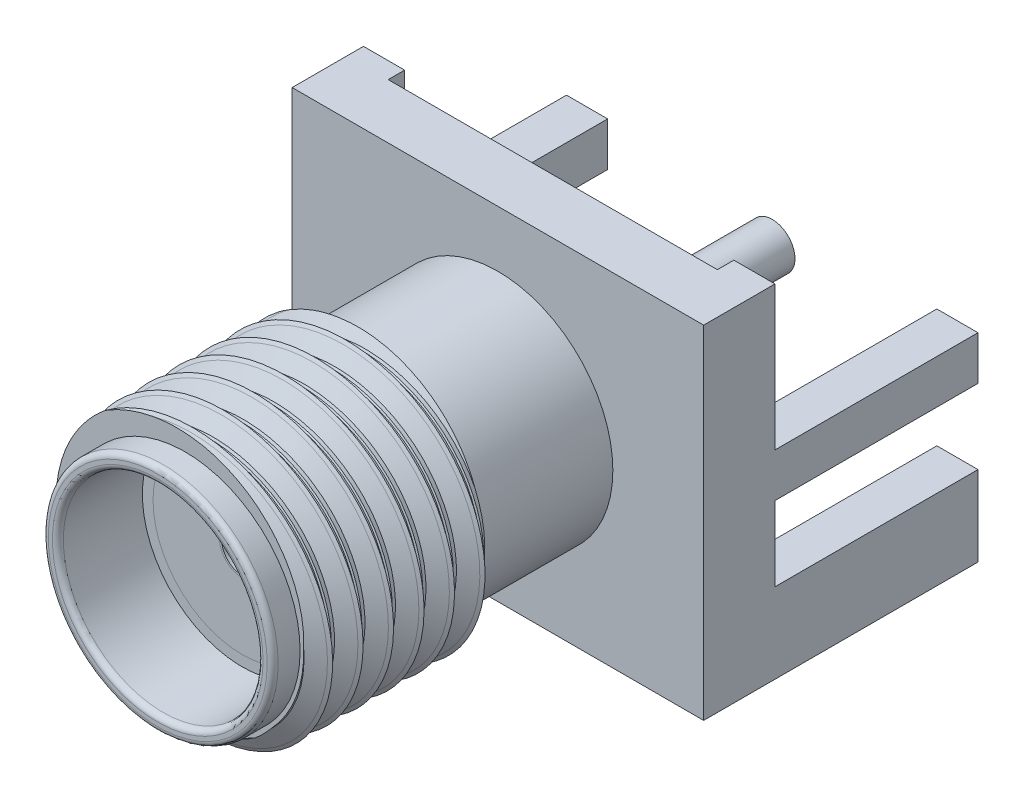
from build123d import *

# Parameters (mm, degrees)
SKETCH1_R           = 2.66065
BOSS_EXTRUDE1_DEPTH = 7.874
SKETCH2_R           = 2.3114
CUT_EXTRUDE1_DEPTH  = 1.9558
SKETCH5_W           = 9.525
SKETCH5_H           = 7.9248
SKETCH5_R           = 2.032
BOSS_EXTRUDE2_DEPTH = 1.651
SKETCH6_W           = 7.62
SKETCH6_H           = 0.381
CUT_EXTRUDE2_DEPTH  = 13.144288258
SKETCH7_R           = 0.47625
CUT_EXTRUDE3_DEPTH  = 10.781350042
SKETCH9_R           = 0.525859375
BOSS_EXTRUDE4_DEPTH = 6.35
SKETCH10_W          = 0.9525
SKETCH10_H          = 1.016
SKETCH10_H_2        = 1.8542
BOSS_EXTRUDE5_DEPTH = 4.699
BOSS_EXTRUDE6_START = -4.826
SKETCH13_R          = 3.16357
SKETCH13_R_2        = 2.66065
BOSS_EXTRUDE6_DEPTH = 4.191
CUT_SWEEP5_PITCH    = 0.705555556
FILLET1_R           = 0.127


with BuildPart() as part:
    # Sketch1 → Boss-Extrude1 (new body)
    with BuildSketch(Plane.XY):
        Circle(SKETCH1_R)
    extrude(amount=BOSS_EXTRUDE1_DEPTH)

    # Sketch2 → Cut-Extrude1 (cut)
    with BuildSketch(Plane.XY.offset(7.874)):
        Circle(SKETCH2_R)
    extrude(amount=-CUT_EXTRUDE1_DEPTH, mode=Mode.SUBTRACT)

    # Sketch7 → Cut-Extrude3 (cut, through all)
    with BuildSketch(Plane.XY.offset(5.9182)):
        Circle(SKETCH7_R)
    extrude(amount=-CUT_EXTRUDE3_DEPTH, mode=Mode.SUBTRACT)

    # Sketch13 → Boss-Extrude6 (add)
    with BuildSketch(Plane.XY.offset(7.874).offset(BOSS_EXTRUDE6_START)):
        Circle(SKETCH13_R)
        Circle(SKETCH13_R_2, mode=Mode.SUBTRACT)
    extrude(amount=BOSS_EXTRUDE6_DEPTH)

    # Cut-Sweep5: the profile of Sketch15 screwed along a right-hand helix of 10 turns, 6 arcs to a turn; built about Z, then put on its axis
    cut_sweep5_z = Axis((0, 0, 0), (0, 0, 1))
    cut_sweep5_corners = [(3.088321503, 0, -0.529337182), (2.74447, 0, -0.330814424), (2.74447, 0, -0.24261998), (3.088321503, 0, -0.044097222), (3.16357, 0, 0), (3.088321503, 0, 0.044097222), (2.74447, 0, 0.24261998), (2.74447, 0, 0.330814424), (3.088321503, 0, 0.529337182), (4.146995867, 0, 0.529337182), (4.146995867, 0, -0.529337182)]
    with BuildLine(mode=Mode.PRIVATE) as cut_sweep5_profile:
        Line(cut_sweep5_corners[0], cut_sweep5_corners[1])
        Line(cut_sweep5_corners[1], cut_sweep5_corners[2])
        Line(cut_sweep5_corners[2], cut_sweep5_corners[3])
        Line(cut_sweep5_corners[3], cut_sweep5_corners[4])
        Line(cut_sweep5_corners[4], cut_sweep5_corners[5])
        Line(cut_sweep5_corners[5], cut_sweep5_corners[6])
        Line(cut_sweep5_corners[6], cut_sweep5_corners[7])
        Line(cut_sweep5_corners[7], cut_sweep5_corners[8])
        Line(cut_sweep5_corners[8], cut_sweep5_corners[9])
        Line(cut_sweep5_corners[9], cut_sweep5_corners[10])
        Line(cut_sweep5_corners[10], cut_sweep5_corners[0])
    cut_sweep5_cap = Face(cut_sweep5_profile.wire())
    cut_sweep5_turn_angles = [0, 30, 60, 90, 120, 150, 180, 210, 240, 270, 300, 330, 360]
    cut_sweep5_turn_weights = [1, 0.8660254037844387, 1, 0.8660254037844387, 1, 0.8660254037844387, 1, 0.8660254037844387, 1, 0.8660254037844387, 1, 0.8660254037844387, 1]
    cut_sweep5_turn_rails = [Edge.make_bspline([Vector(p[0], p[1], 0).rotate(cut_sweep5_z, cut_sweep5_turn_angles[k]) / cut_sweep5_turn_weights[k] + Vector(0, 0, p[2] + CUT_SWEEP5_PITCH * cut_sweep5_turn_angles[k] / 360) for k in range(13)], [0, 0, 0, 1, 1, 2, 2, 3, 3, 4, 4, 5, 5, 6, 6, 6], 2, cut_sweep5_turn_weights) for p in cut_sweep5_corners]
    cut_sweep5_turn_sides = [Face.make_surface_from_curves(cut_sweep5_turn_rails[p[0]], cut_sweep5_turn_rails[p[1]]) for p in [(0, 1), (1, 2), (2, 3), (3, 4), (4, 5), (5, 6), (6, 7), (7, 8), (8, 9), (9, 10), (10, 0)]]
    cut_sweep5_turn = Solid(Shell([*cut_sweep5_turn_sides, cut_sweep5_cap, cut_sweep5_cap.rotate(cut_sweep5_z, 360).moved(Location((0, 0, CUT_SWEEP5_PITCH * 360 / 360)))]))
    cut_sweep5_each = [*[cut_sweep5_turn.moved(Location((0, 0, CUT_SWEEP5_PITCH * i))) for i in range(10)]]
    add(Plane(origin=(0, 0, 7.874), x_dir=(0, 1, 0), z_dir=(0, 0, -1)) * Compound([cut_sweep5_each[i] for i in range(0, 10, 2)]), mode=Mode.SUBTRACT)
    add(Plane(origin=(0, 0, 7.874), x_dir=(0, 1, 0), z_dir=(0, 0, -1)) * Compound([cut_sweep5_each[i] for i in range(1, 10, 2)]), mode=Mode.SUBTRACT)

    # Fillet1
    fillet1_edges = [part.edges().sort_by_distance(p)[0] for p in [
        (-2.66065, 0, 7.874),
        (-2.3114, 0, 7.874),
    ]]
    fillet(fillet1_edges, radius=FILLET1_R)


with BuildPart() as body_2:
    # Sketch5 → Boss-Extrude2 (new body)
    with BuildSketch(Plane(origin=(0, 0, 0), x_dir=(-1, 0, 0), z_dir=(0, 0, -1))):
        Rectangle(SKETCH5_W, SKETCH5_H)
        with Locations(Location((0, 0, 0), (0, 0, 180))):
            Circle(SKETCH5_R, mode=Mode.SUBTRACT)
    extrude(amount=BOSS_EXTRUDE2_DEPTH)

    # Sketch6 → Cut-Extrude2 (cut, through all)
    with BuildSketch(Plane(origin=(0, 3.9624, 0), x_dir=(1, 0, 0), z_dir=(0, 1, 0))):
        with Locations((0, 1.4605)):
            Rectangle(SKETCH6_W, SKETCH6_H)
    extrude(amount=-CUT_EXTRUDE2_DEPTH, mode=Mode.SUBTRACT)

    # Sketch10 → Boss-Extrude5 (add)
    with BuildSketch(Plane(origin=(0, 0, -1.651), x_dir=(-1, 0, 0), z_dir=(0, 0, -1))):
        with Locations((4.28625, 0.127)):
            Rectangle(SKETCH10_W, SKETCH10_H)
        with Locations((4.28625, -3.0353)):
            Rectangle(SKETCH10_W, SKETCH10_H_2)
        with Locations((-4.28625, -3.0353)):
            Rectangle(SKETCH10_W, SKETCH10_H_2)
        with Locations((-4.28625, 0.127)):
            Rectangle(SKETCH10_W, SKETCH10_H)
    extrude(amount=BOSS_EXTRUDE5_DEPTH)


with BuildPart() as body_3:
    # Sketch9 → Boss-Extrude4 (new body)
    with BuildSketch(Plane.XY):
        Circle(SKETCH9_R)
    extrude(amount=-BOSS_EXTRUDE4_DEPTH)


solid = Compound([part.part, body_2.part, body_3.part])
